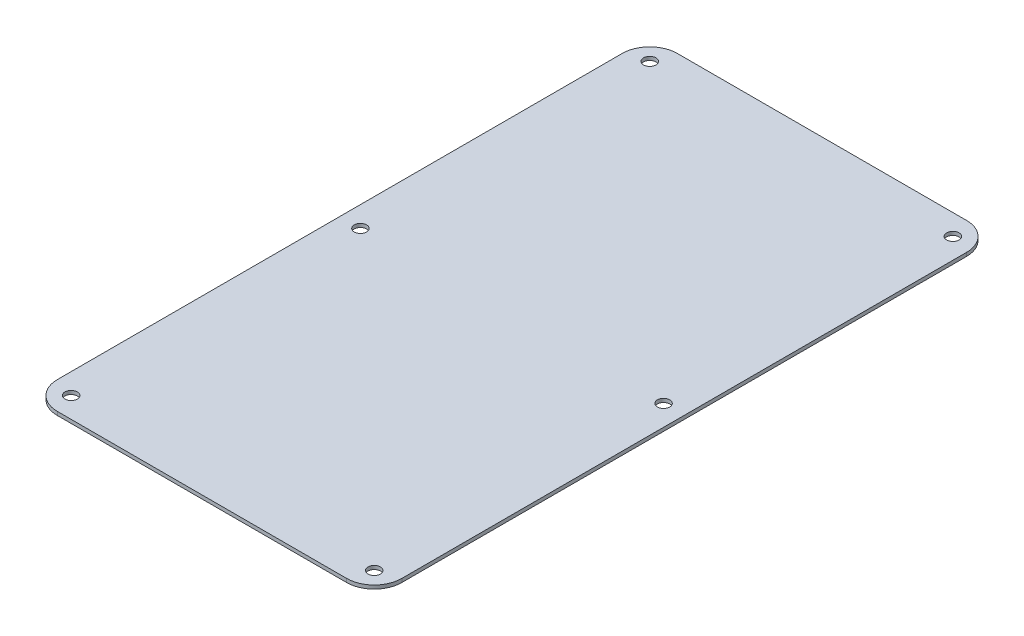
from build123d import *

# Parameters (mm, degrees)
SKETCH1_W          = 125
SKETCH1_H          = 225
BASE_FLANGE1_DEPTH = 1.3
SKETCH6_R          = 2.25
CUT_EXTRUDE1_DEPTH = 10
FILLET1_R          = 10


# Sheet-metal steps are written as plain solids
with BuildPart() as part:
    # Sketch1 → Base-Flange1 (new body)
    with BuildSketch(Plane(origin=(0, 0, 0), x_dir=(1, 0, 0), z_dir=(0, 1, 0))):
        with Locations((-1.187869711, 9.383580575)):
            Rectangle(SKETCH1_W, SKETCH1_H)
    extrude(amount=-BASE_FLANGE1_DEPTH)

    # Sketch6 → Cut-Extrude1 (cut)
    with BuildSketch(Plane(origin=(0, 0, 0), x_dir=(1, 0, 0), z_dir=(0, 1, 0))):
        with Locations(Location((53.812130289, 114.383580575, 0), (0, 0, 270))):
            Circle(SKETCH6_R)
        with Locations(Location((53.812130289, -95.616419425, 0), (0, 0, 270))):
            Circle(SKETCH6_R)
        with Locations(Location((-56.187869711, -95.616419425, 0), (0, 0, 270))):
            Circle(SKETCH6_R)
        with Locations(Location((-56.187869711, 114.383580575, 0), (0, 0, 270))):
            Circle(SKETCH6_R)
        with Locations(Location((53.812130289, 9.383580575, 0), (0, 0, 270))):
            Circle(SKETCH6_R)
        with Locations(Location((-56.187869711, 9.383580575, 0), (0, 0, 270))):
            Circle(SKETCH6_R)
    extrude(amount=-CUT_EXTRUDE1_DEPTH, mode=Mode.SUBTRACT)

    # Fillet1
    fillet1_edges = [part.edges().sort_by_distance(p)[0] for p in [
        (61.312130289, -0.65, 103.116419425),
        (-63.687869711, -0.65, 103.116419425),
        (-63.687869711, -0.65, -121.883580575),
        (61.312130289, -0.65, -121.883580575),
    ]]
    fillet(fillet1_edges, radius=FILLET1_R)


solid = part.part
